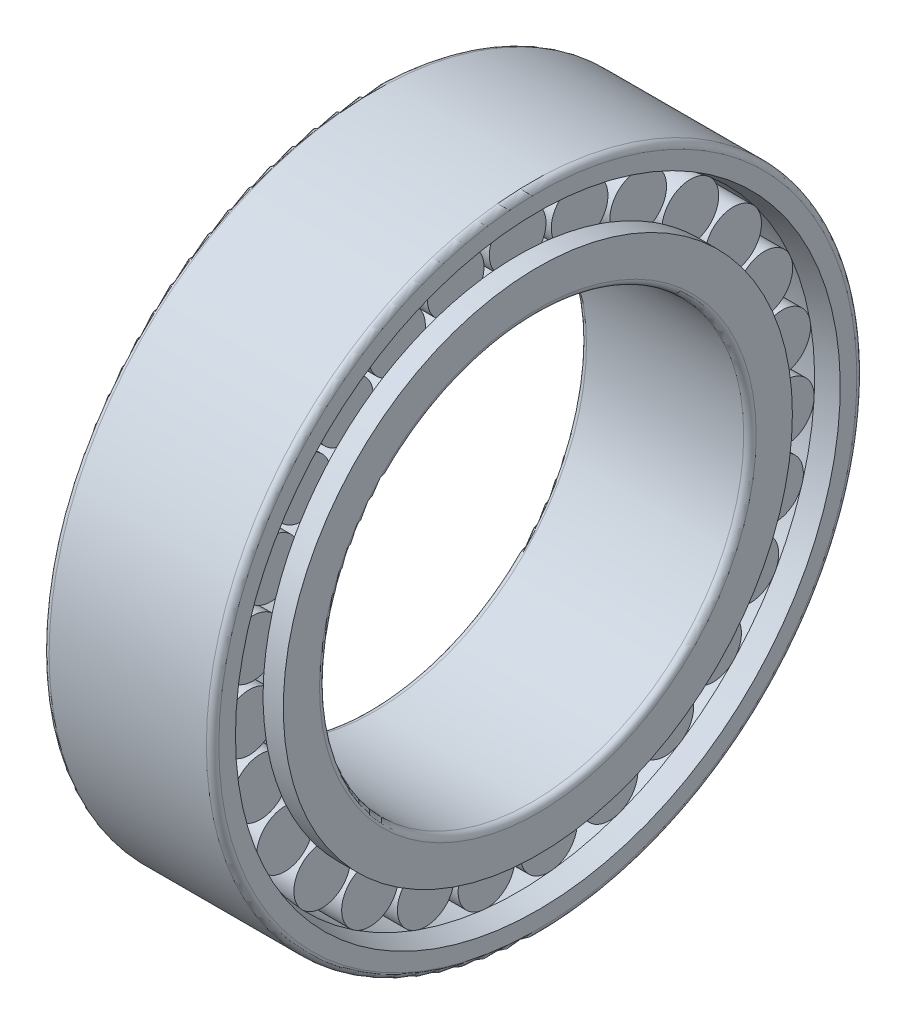
from build123d import *

# Parameters (mm, degrees)
SKETCH_4_W               = 8.571428572
SKETCH_4_H               = 5.001
SKETCH_5_W               = 8.571428572
SKETCH_5_H               = 5.01
PATTERN_CIRCULAR_2_COUNT = 27


with BuildPart() as part:
    # 草图1 → Revolve 5248 (revolve)
    with BuildSketch(Plane.XY):
        with BuildLine():
            Line((1.1, 57.5), (28.9, 57.5))
            ThreePointArc((28.9, 57.5), (29.677817459, 57.177817459), (30, 56.4))
            Line((30, 56.4), (30, 53.456961402))
            Line((30, 53.456961402), (26.428571429, 52.5))
            Line((26.428571429, 52.5), (3.571428571, 52.5))
            Line((3.571428571, 52.5), (0, 53.456961402))
            Line((0, 53.456961402), (0, 56.4))
            ThreePointArc((0, 56.4), (0.322182541, 57.177817459), (1.1, 57.5))
        make_face()
    revolve(axis=Axis((0, 0, 0), (1, 0, 0)))

    # 草图4 → 凸台-旋转1 (revolve)
    with BuildSketch(Plane.XY):
        with Locations((7.857142857, 50.0005)):
            Rectangle(SKETCH_4_W, SKETCH_4_H)
    revolve_1 = revolve(axis=Axis((-94.048758784, 47.5, 0), (1, 0, 0)))

    # 草图5 → 凸台-旋转2 (revolve)
    with BuildSketch(Plane.XY):
        with Locations((22.142857143, 50.005)):
            Rectangle(SKETCH_5_W, SKETCH_5_H)
    revolve_2 = revolve(axis=Axis((-94.048758784, 47.5, 0), (1, 0, 0)))

    # 草图2 → 凸台-旋转3 (revolve)
    with BuildSketch(Plane.XY):
        with BuildLine():
            Line((26.428571429, 42.5), (26.428571429, 45))
            Line((26.428571429, 45), (30, 45))
            Line((30, 45), (30, 38.6))
            ThreePointArc((30, 38.6), (29.677817459, 37.822182541), (28.9, 37.5))
            Line((28.9, 37.5), (1.1, 37.5))
            ThreePointArc((1.1, 37.5), (0.322182541, 37.822182541), (0, 38.6))
            Line((0, 38.6), (0, 45))
            Line((0, 45), (3.571428571, 45))
            Line((3.571428571, 45), (3.571428571, 42.5))
            Line((3.571428571, 42.5), (12.142857143, 42.5))
            Line((12.142857143, 42.5), (12.142857143, 45))
            Line((12.142857143, 45), (17.857142857, 45))
            Line((17.857142857, 45), (17.857142857, 42.5))
            Line((17.857142857, 42.5), (26.428571429, 42.5))
        make_face()
    revolve(axis=Axis((0, 0, 0), (-1, 0, 0)))

    # 阵列(圆周)2: 凸台-旋转1, 凸台-旋转2 ×27 about axis
    pattern_circular_2_axis = Axis((-5.3, 0, 0), (1, 0, 0))
    add([revolve_1.rotate(pattern_circular_2_axis, i * 360 / PATTERN_CIRCULAR_2_COUNT) for i in range(1, PATTERN_CIRCULAR_2_COUNT)])
    add([revolve_2.rotate(pattern_circular_2_axis, i * 360 / PATTERN_CIRCULAR_2_COUNT) for i in range(1, PATTERN_CIRCULAR_2_COUNT)])


solid = part.part
